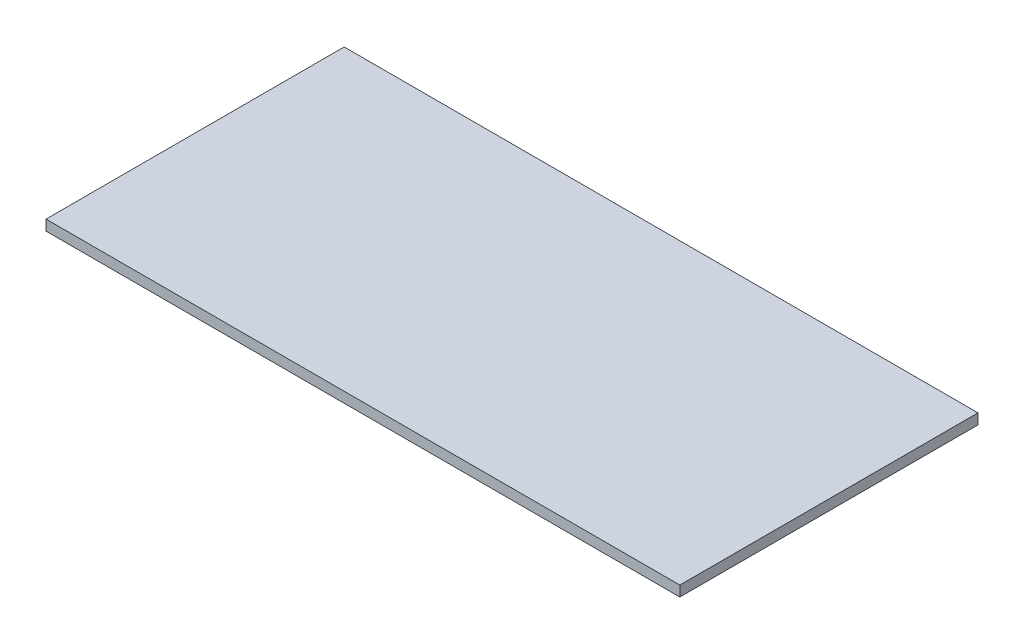
from build123d import *

# Parameters (mm, degrees)
SKETCH1_W           = 914
SKETCH1_H           = 430
BOSS_EXTRUDE1_DEPTH = 15


with BuildPart() as part:
    # Sketch1 → Boss-Extrude1 (new body)
    with BuildSketch(Plane(origin=(0, 0, 0), x_dir=(1, 0, 0), z_dir=(0, 1, 0))):
        Rectangle(SKETCH1_W, SKETCH1_H)
    extrude(amount=BOSS_EXTRUDE1_DEPTH)


solid = part.part
